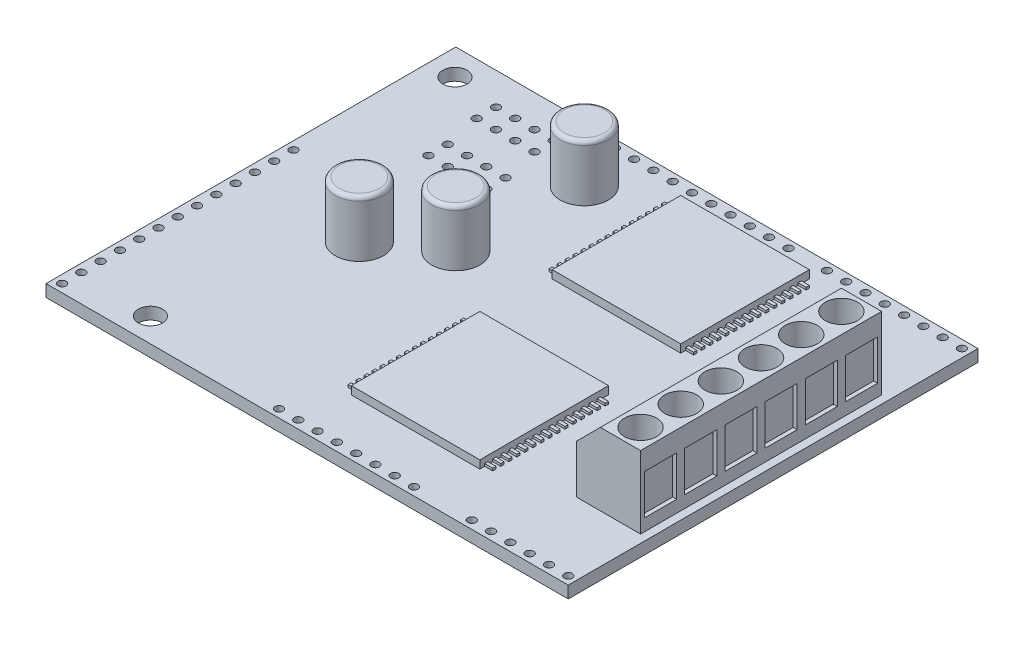
from build123d import *

# Parameters (mm, degrees)
SKETCH_1_W          = 65
SKETCH_1_H          = 51
EXTRUDE_1_DEPTH     = 1.5
SKETCH_2_W          = 16
SKETCH_2_H          = 16
EXTRUDE_2_DEPTH     = 1
SKETCH_3_W          = 1
SKETCH_3_H          = 0.4
EXTRUDE_3_DEPTH     = 0.3
SKETCH_4_R          = 0.5
SKETCH_4_R_2        = 1.5
CUT_EXTRUDE_1_DEPTH = 2
SKETCH_5_W          = 8
SKETCH_5_H          = 30
EXTRUDE_4_DEPTH     = 9
CHAMFER_1_SIZE      = 3
SKETCH_6_R          = 2
CUT_EXTRUDE_2_DEPTH = 4
SKETCH_7_W          = 4
SKETCH_7_H          = 5
CUT_EXTRUDE_3_DEPTH = 0.5
SKETCH_8_R          = 0.5
CUT_EXTRUDE_4_DEPTH = 0.2
SKETCH_9_R          = 3
EXTRUDE_5_DEPTH     = 7
FILLET_1_R          = 0.5


with BuildPart() as part:
    # Эскиз1 → Бобышка-Вытянуть1 (new body)
    with BuildSketch(Plane(origin=(0, 0, 0), x_dir=(1, 0, 0), z_dir=(0, 1, 0))):
        Rectangle(SKETCH_1_W, SKETCH_1_H)
    extrude(amount=EXTRUDE_1_DEPTH)

    # Эскиз2 → Бобышка-Вытянуть2 (add)
    with BuildSketch(Plane(origin=(0, 1.5, 0), x_dir=(1, 0, 0), z_dir=(0, 1, 0))):
        with Locations((6.5, 14.5)):
            Rectangle(SKETCH_2_W, SKETCH_2_H)
        with Locations((6.5, -10.5)):
            Rectangle(SKETCH_2_W, SKETCH_2_H)
    extrude(amount=EXTRUDE_2_DEPTH)

    # Эскиз3 → Бобышка-Вытянуть3 (add)
    with BuildSketch(Plane(origin=(0, 1.5, 0), x_dir=(1, 0, 0), z_dir=(0, 1, 0))):
        with Locations((15, 21.3)):
            Rectangle(SKETCH_3_W, SKETCH_3_H)
        with Locations((15, 20.3)):
            Rectangle(SKETCH_3_W, SKETCH_3_H)
        with Locations((15, 19.3)):
            Rectangle(SKETCH_3_W, SKETCH_3_H)
        with Locations((15, 18.3)):
            Rectangle(SKETCH_3_W, SKETCH_3_H)
        with Locations((15, 17.3)):
            Rectangle(SKETCH_3_W, SKETCH_3_H)
        with Locations((15, 16.3)):
            Rectangle(SKETCH_3_W, SKETCH_3_H)
        with Locations((15, 15.3)):
            Rectangle(SKETCH_3_W, SKETCH_3_H)
        with Locations((15, 14.3)):
            Rectangle(SKETCH_3_W, SKETCH_3_H)
        with Locations((15, 13.3)):
            Rectangle(SKETCH_3_W, SKETCH_3_H)
        with Locations((15, 12.3)):
            Rectangle(SKETCH_3_W, SKETCH_3_H)
        with Locations((15, 11.3)):
            Rectangle(SKETCH_3_W, SKETCH_3_H)
        with Locations((15, 10.3)):
            Rectangle(SKETCH_3_W, SKETCH_3_H)
        with Locations((15, 9.3)):
            Rectangle(SKETCH_3_W, SKETCH_3_H)
        with Locations((15, 8.3)):
            Rectangle(SKETCH_3_W, SKETCH_3_H)
        with Locations((15, 7.3)):
            Rectangle(SKETCH_3_W, SKETCH_3_H)
        with Locations((-2, 7.3)):
            Rectangle(SKETCH_3_W, SKETCH_3_H)
        with Locations((-2, 8.3)):
            Rectangle(SKETCH_3_W, SKETCH_3_H)
        with Locations((-2, 9.3)):
            Rectangle(SKETCH_3_W, SKETCH_3_H)
        with Locations((-2, 10.3)):
            Rectangle(SKETCH_3_W, SKETCH_3_H)
        with Locations((-2, 11.3)):
            Rectangle(SKETCH_3_W, SKETCH_3_H)
        with Locations((-2, 12.3)):
            Rectangle(SKETCH_3_W, SKETCH_3_H)
        with Locations((-2, 13.3)):
            Rectangle(SKETCH_3_W, SKETCH_3_H)
        with Locations((-2, 14.3)):
            Rectangle(SKETCH_3_W, SKETCH_3_H)
        with Locations((-2, 15.3)):
            Rectangle(SKETCH_3_W, SKETCH_3_H)
        with Locations((-2, 16.3)):
            Rectangle(SKETCH_3_W, SKETCH_3_H)
        with Locations((-2, 17.3)):
            Rectangle(SKETCH_3_W, SKETCH_3_H)
        with Locations((-2, 18.3)):
            Rectangle(SKETCH_3_W, SKETCH_3_H)
        with Locations((-2, 19.3)):
            Rectangle(SKETCH_3_W, SKETCH_3_H)
        with Locations((-2, 20.3)):
            Rectangle(SKETCH_3_W, SKETCH_3_H)
        with Locations((-2, 21.3)):
            Rectangle(SKETCH_3_W, SKETCH_3_H)
        with Locations((15, -3.7)):
            Rectangle(SKETCH_3_W, SKETCH_3_H)
        with Locations((15, -4.7)):
            Rectangle(SKETCH_3_W, SKETCH_3_H)
        with Locations((15, -5.7)):
            Rectangle(SKETCH_3_W, SKETCH_3_H)
        with Locations((15, -6.7)):
            Rectangle(SKETCH_3_W, SKETCH_3_H)
        with Locations((15, -7.7)):
            Rectangle(SKETCH_3_W, SKETCH_3_H)
        with Locations((15, -8.7)):
            Rectangle(SKETCH_3_W, SKETCH_3_H)
        with Locations((15, -9.7)):
            Rectangle(SKETCH_3_W, SKETCH_3_H)
        with Locations((15, -10.7)):
            Rectangle(SKETCH_3_W, SKETCH_3_H)
        with Locations((15, -11.7)):
            Rectangle(SKETCH_3_W, SKETCH_3_H)
        with Locations((15, -12.7)):
            Rectangle(SKETCH_3_W, SKETCH_3_H)
        with Locations((15, -13.7)):
            Rectangle(SKETCH_3_W, SKETCH_3_H)
        with Locations((15, -14.7)):
            Rectangle(SKETCH_3_W, SKETCH_3_H)
        with Locations((15, -15.7)):
            Rectangle(SKETCH_3_W, SKETCH_3_H)
        with Locations((15, -16.7)):
            Rectangle(SKETCH_3_W, SKETCH_3_H)
        with Locations((15, -17.7)):
            Rectangle(SKETCH_3_W, SKETCH_3_H)
        with Locations((-2, -17.7)):
            Rectangle(SKETCH_3_W, SKETCH_3_H)
        with Locations((-2, -16.7)):
            Rectangle(SKETCH_3_W, SKETCH_3_H)
        with Locations((-2, -15.7)):
            Rectangle(SKETCH_3_W, SKETCH_3_H)
        with Locations((-2, -14.7)):
            Rectangle(SKETCH_3_W, SKETCH_3_H)
        with Locations((-2, -13.7)):
            Rectangle(SKETCH_3_W, SKETCH_3_H)
        with Locations((-2, -12.7)):
            Rectangle(SKETCH_3_W, SKETCH_3_H)
        with Locations((-2, -11.7)):
            Rectangle(SKETCH_3_W, SKETCH_3_H)
        with Locations((-2, -10.7)):
            Rectangle(SKETCH_3_W, SKETCH_3_H)
        with Locations((-2, -9.7)):
            Rectangle(SKETCH_3_W, SKETCH_3_H)
        with Locations((-2, -8.7)):
            Rectangle(SKETCH_3_W, SKETCH_3_H)
        with Locations((-2, -7.7)):
            Rectangle(SKETCH_3_W, SKETCH_3_H)
        with Locations((-2, -6.7)):
            Rectangle(SKETCH_3_W, SKETCH_3_H)
        with Locations((-2, -5.7)):
            Rectangle(SKETCH_3_W, SKETCH_3_H)
        with Locations((-2, -4.7)):
            Rectangle(SKETCH_3_W, SKETCH_3_H)
        with Locations((-2, -3.7)):
            Rectangle(SKETCH_3_W, SKETCH_3_H)
    extrude(amount=EXTRUDE_3_DEPTH)

    # Эскиз4 → Вырез-Вытянуть1 (cut)
    with BuildSketch(Plane(origin=(0, 1.5, 0), x_dir=(1, 0, 0), z_dir=(0, 1, 0))):
        with Locations((31.5, -24.5)):
            Circle(SKETCH_4_R)
        with Locations((29.1, -24.5)):
            Circle(SKETCH_4_R)
        with Locations((26.7, -24.5)):
            Circle(SKETCH_4_R)
        with Locations((24.3, -24.5)):
            Circle(SKETCH_4_R)
        with Locations((21.9, -24.5)):
            Circle(SKETCH_4_R)
        with Locations((19.5, -24.5)):
            Circle(SKETCH_4_R)
        with Locations((31.5, 24.5)):
            Circle(SKETCH_4_R)
        with Locations((29.1, 24.5)):
            Circle(SKETCH_4_R)
        with Locations((12.3, -24.5)):
            Circle(SKETCH_4_R)
        with Locations((9.9, -24.5)):
            Circle(SKETCH_4_R)
        with Locations((7.5, -24.5)):
            Circle(SKETCH_4_R)
        with Locations((5.1, -24.5)):
            Circle(SKETCH_4_R)
        with Locations((2.7, -24.5)):
            Circle(SKETCH_4_R)
        with Locations((0.3, -24.5)):
            Circle(SKETCH_4_R)
        with Locations((-2.1, -24.5)):
            Circle(SKETCH_4_R)
        with Locations((-4.5, -24.5)):
            Circle(SKETCH_4_R)
        with Locations((26.7, 24.5)):
            Circle(SKETCH_4_R)
        with Locations((24.3, 24.5)):
            Circle(SKETCH_4_R)
        with Locations((21.9, 24.5)):
            Circle(SKETCH_4_R)
        with Locations((19.5, 24.5)):
            Circle(SKETCH_4_R)
        with Locations((17.1, 24.5)):
            Circle(SKETCH_4_R)
        with Locations((14.7, 24.5)):
            Circle(SKETCH_4_R)
        with Locations((-31.5, -24.5)):
            Circle(SKETCH_4_R)
        with Locations((9.9, 24.5)):
            Circle(SKETCH_4_R)
        with Locations((7.5, 24.5)):
            Circle(SKETCH_4_R)
        with Locations((5.1, 24.5)):
            Circle(SKETCH_4_R)
        with Locations((2.7, 24.5)):
            Circle(SKETCH_4_R)
        with Locations((0.3, 24.5)):
            Circle(SKETCH_4_R)
        with Locations((-2.1, 24.5)):
            Circle(SKETCH_4_R)
        with Locations((-4.5, 24.5)):
            Circle(SKETCH_4_R)
        with Locations((-6.9, 24.5)):
            Circle(SKETCH_4_R)
        with Locations((-9.3, 24.5)):
            Circle(SKETCH_4_R)
        with Locations((-11.7, 24.5)):
            Circle(SKETCH_4_R)
        with Locations((-31.5, -22.1)):
            Circle(SKETCH_4_R)
        with Locations((-31.5, -19.7)):
            Circle(SKETCH_4_R)
        with Locations((-31.5, -17.3)):
            Circle(SKETCH_4_R)
        with Locations((-31.5, -14.9)):
            Circle(SKETCH_4_R)
        with Locations((-31.5, -12.5)):
            Circle(SKETCH_4_R)
        with Locations((-31.5, -10.1)):
            Circle(SKETCH_4_R)
        with Locations((-31.5, -7.7)):
            Circle(SKETCH_4_R)
        with Locations((-31.5, -5.3)):
            Circle(SKETCH_4_R)
        with Locations((-31.5, -2.9)):
            Circle(SKETCH_4_R)
        with Locations((-31.5, -0.5)):
            Circle(SKETCH_4_R)
        with Locations((-31.5, 1.9)):
            Circle(SKETCH_4_R)
        with Locations((-31.5, 4.3)):
            Circle(SKETCH_4_R)
        with Locations((-29.3, 22.2)):
            Circle(SKETCH_4_R_2)
        with Locations((-22.5, -22.5)):
            Circle(SKETCH_4_R_2)
        with Locations((-23.5, 21.5)):
            Circle(SKETCH_4_R)
        with Locations((-21.1, 21.5)):
            Circle(SKETCH_4_R)
        with Locations((-18.7, 21.5)):
            Circle(SKETCH_4_R)
        with Locations((-16.3, 21.5)):
            Circle(SKETCH_4_R)
        with Locations((-21.1, 19.1)):
            Circle(SKETCH_4_R)
        with Locations((-18.7, 19.1)):
            Circle(SKETCH_4_R)
        with Locations((-16.3, 19.1)):
            Circle(SKETCH_4_R)
        with Locations((-23.5, 19.1)):
            Circle(SKETCH_4_R)
        with Locations((-22.5, 14.5)):
            Circle(SKETCH_4_R)
        with Locations((-20.1, 14.5)):
            Circle(SKETCH_4_R)
        with Locations((-17.7, 14.5)):
            Circle(SKETCH_4_R)
        with Locations((-15.3, 14.5)):
            Circle(SKETCH_4_R)
        with Locations((-20.1, 12.1)):
            Circle(SKETCH_4_R)
        with Locations((-17.7, 12.1)):
            Circle(SKETCH_4_R)
        with Locations((-15.3, 12.1)):
            Circle(SKETCH_4_R)
        with Locations((-22.5, 12.1)):
            Circle(SKETCH_4_R)
    extrude(amount=-CUT_EXTRUDE_1_DEPTH, mode=Mode.SUBTRACT)

    # Эскиз5 → Бобышка-Вытянуть4 (add)
    with BuildSketch(Plane(origin=(0, 1.5, 0), x_dir=(1, 0, 0), z_dir=(0, 1, 0))):
        with Locations((27.5, -0.5)):
            Rectangle(SKETCH_5_W, SKETCH_5_H)
    extrude(amount=EXTRUDE_4_DEPTH)

    # Фаска1
    chamfer_1_edges = [part.edges().sort_by_distance(p)[0] for p in [
        (23.5, 10.5, 0.5),
    ]]
    chamfer(chamfer_1_edges, length=CHAMFER_1_SIZE)

    # Эскиз6 → Вырез-Вытянуть2 (cut)
    with BuildSketch(Plane(origin=(0, 10.5, 0), x_dir=(1, 0, 0), z_dir=(0, 1, 0))):
        with Locations((28.999276904, 12)):
            Circle(SKETCH_6_R)
        with Locations((28.999276904, 7)):
            Circle(SKETCH_6_R)
        with Locations((28.999276904, 2)):
            Circle(SKETCH_6_R)
        with Locations((28.999276904, -3)):
            Circle(SKETCH_6_R)
        with Locations((28.999276904, -8)):
            Circle(SKETCH_6_R)
        with Locations((28.999276904, -13)):
            Circle(SKETCH_6_R)
    extrude(amount=-CUT_EXTRUDE_2_DEPTH, mode=Mode.SUBTRACT)

    # Эскиз7 → Вырез-Вытянуть3 (cut)
    with BuildSketch(Plane(origin=(31.5, 0, 0), x_dir=(0, 0, -1), z_dir=(1, 0, 0))):
        with Locations((12, 5.5)):
            Rectangle(SKETCH_7_W, SKETCH_7_H)
        with Locations((7, 5.5)):
            Rectangle(SKETCH_7_W, SKETCH_7_H)
        with Locations((2, 5.5)):
            Rectangle(SKETCH_7_W, SKETCH_7_H)
        with Locations((-3, 5.5)):
            Rectangle(SKETCH_7_W, SKETCH_7_H)
        with Locations((-8, 5.5)):
            Rectangle(SKETCH_7_W, SKETCH_7_H)
        with Locations((-13, 5.5)):
            Rectangle(SKETCH_7_W, SKETCH_7_H)
    extrude(amount=-CUT_EXTRUDE_3_DEPTH, mode=Mode.SUBTRACT)

    # Эскиз8 → Вырез-Вытянуть4 (cut)
    with BuildSketch(Plane(origin=(8, -8, 0), x_dir=(0, 0, 1), z_dir=(-0.7071067811865495, 0.7071067811865457, 0))):
        with Locations((-12, 23.920310217)):
            Circle(SKETCH_8_R)
        with Locations((-7, 23.920310217)):
            Circle(SKETCH_8_R)
        with Locations((-2, 23.920310217)):
            Circle(SKETCH_8_R)
        with Locations((3, 23.920310217)):
            Circle(SKETCH_8_R)
        with Locations((8, 23.920310217)):
            Circle(SKETCH_8_R)
        with Locations((13, 23.920310217)):
            Circle(SKETCH_8_R)
    extrude(amount=-CUT_EXTRUDE_4_DEPTH, mode=Mode.SUBTRACT)

    # Эскиз9 → Бобышка-Вытянуть5 (add)
    with BuildSketch(Plane(origin=(0, 1.5, 0), x_dir=(1, 0, 0), z_dir=(0, 1, 0))):
        with Locations((-9.5, 18.5)):
            Circle(SKETCH_9_R)
        with Locations((-17.5, -1.5)):
            Circle(SKETCH_9_R)
        with Locations((-10.5, 3.5)):
            Circle(SKETCH_9_R)
    extrude(amount=EXTRUDE_5_DEPTH)

    # Скругление1
    fillet_1_edges = [part.edges().sort_by_distance(p)[0] for p in [
        (-20.5, 8.5, 1.5),
        (-13.5, 8.5, -3.5),
        (-12.5, 8.5, -18.5),
    ]]
    fillet(fillet_1_edges, radius=FILLET_1_R)


solid = part.part
